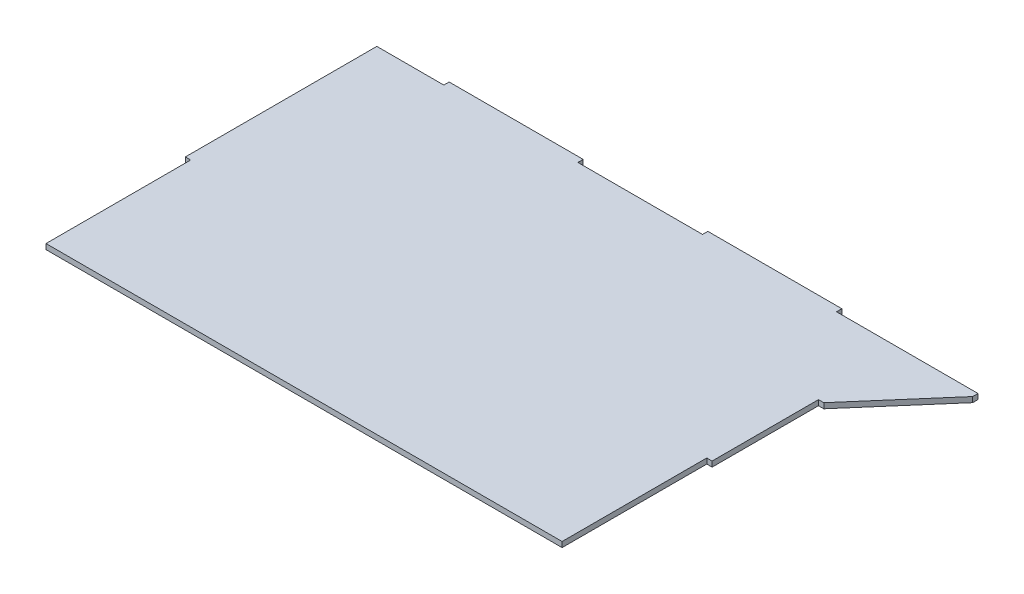
from build123d import *

# Parameters (mm, degrees)
SKETCH1_W           = 314.43168
SKETCH1_H           = 3.175
BOSS_EXTRUDE1_DEPTH = 200.66180012
CUT_EXTRUDE2_START  = -3.175
SKETCH5_W           = 3.175
SKETCH5_H           = 86.36
CUT_EXTRUDE2_DEPTH  = 259.11040162
SKETCH3_W           = 80
SKETCH3_H           = 3.175
BOSS_EXTRUDE2_DEPTH = 3.175
LPATTERN2_COUNT     = 2
LPATTERN2_PITCH     = 154.43
BOSS_EXTRUDE3_DEPTH = 3.175


with BuildPart() as part:
    # Sketch1 → Boss-Extrude1 (new body)
    with BuildSketch(Plane.XY):
        Rectangle(SKETCH1_W, SKETCH1_H)
    extrude(amount=BOSS_EXTRUDE1_DEPTH)

    # Sketch5 → Cut-Extrude2 (cut)
    with BuildSketch(Plane(origin=(0, 1.5875, 0), x_dir=(1, 0, 0), z_dir=(0, 1, 0)).offset(CUT_EXTRUDE2_START)):
        with Locations((-155.62834, -157.48180012)):
            Rectangle(SKETCH5_W, SKETCH5_H)
    cut_extrude2 = extrude(amount=CUT_EXTRUDE2_DEPTH, mode=Mode.SUBTRACT)

    # Mirror1: Cut-Extrude2 across plane
    add(cut_extrude2.mirror(Plane(origin=(0, 0, 0), x_dir=(0, 0, 1), z_dir=(1, 0, 0))), mode=Mode.SUBTRACT)

    # Sketch3 → Boss-Extrude2 (add)
    with BuildSketch(Plane(origin=(0, 0, 0), x_dir=(-1, 0, 0), z_dir=(0, 0, -1))):
        with Locations((-77.21584, 0)):
            Rectangle(SKETCH3_W, SKETCH3_H)
    boss_extrude2 = extrude(amount=BOSS_EXTRUDE2_DEPTH)

    # LPattern2: Boss-Extrude2 ×2
    with Locations(*[(-i * LPATTERN2_PITCH, 0, 0) for i in range(1, LPATTERN2_COUNT)]):
        add(boss_extrude2)

    # Sketch10 → Boss-Extrude3 (add)
    with BuildSketch(Plane.XZ.offset(1.5875)):
        Polygon((201.6506, 0), (201.6506, 3.175), (160.39084, 50.8), (157.21584, 50.8), (157.21584, 0), align=None)
    extrude(amount=-BOSS_EXTRUDE3_DEPTH)


solid = part.part
